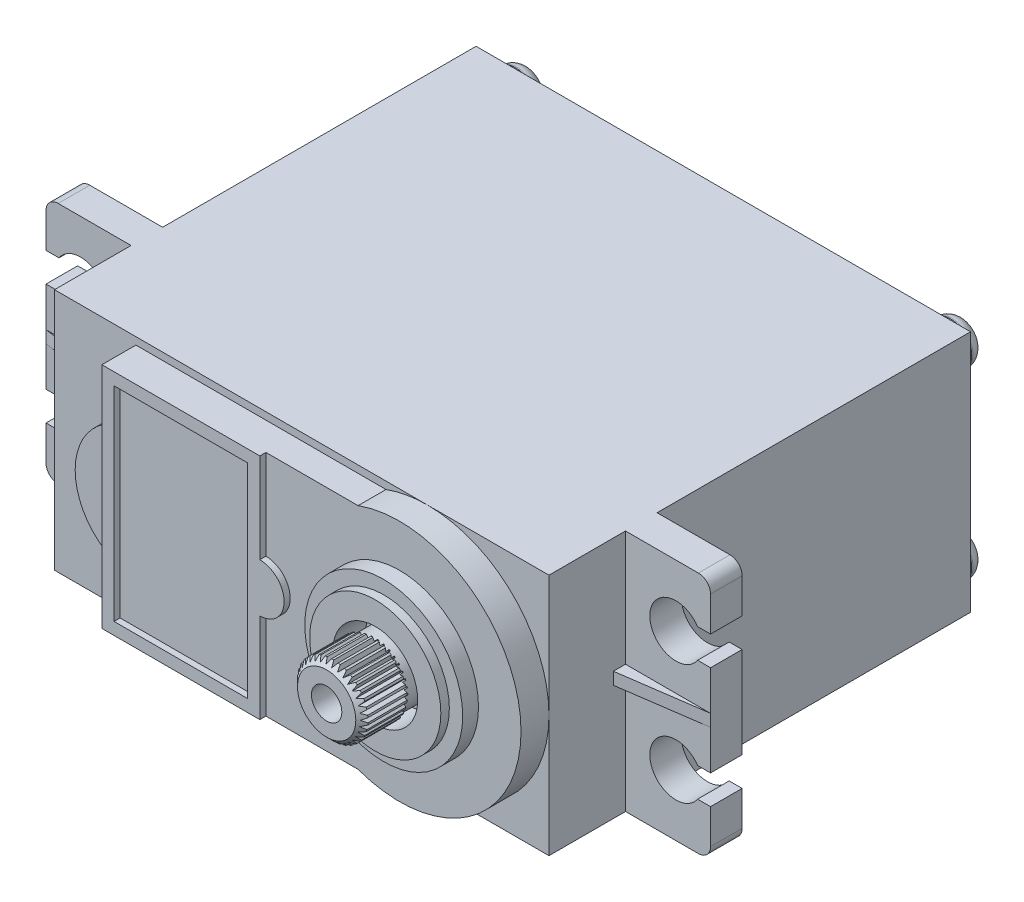
from build123d import *

# Parameters (mm, degrees)
SKETCH1_W                         = 40.7
SKETCH1_H                         = 36.7
BOSS_EXTRUDE1_DEPTH               = 20
CHAMFER1_SIZE                     = 2
CUT_EXTRUDE1_DEPTH                = 1.2
SKETCH3_R                         = 1.75
BOSS_EXTRUDE2_DEPTH               = 1.1
FILLET1_R                         = 1
SKETCH4_W                         = 2.5
SKETCH4_H                         = 0.75
CUT_EXTRUDE_THIN1_DEPTH           = 0.5
CUT_EXTRUDE_THIN1_DRAFT           = -18
SKETCH4_W_2                       = 0.75
SKETCH4_H_2                       = 2.5
CUT_EXTRUDE_THIN1_PROFILE_2_DEPTH = 0.5
CUT_EXTRUDE_THIN1_PROFILE_2_DRAFT = -18
SKETCH5_R                         = 10
BOSS_EXTRUDE3_DEPTH               = 2.3
SKETCH6_R                         = 5.34
BOSS_EXTRUDE4_DEPTH               = 2
SKETCH7_R                         = 6.5
BOSS_EXTRUDE5_DEPTH               = 1.3
SKETCH8_R                         = 5.4
BOSS_EXTRUDE6_DEPTH               = 2
SKETCH9_R                         = 3
CUT_EXTRUDE2_DEPTH                = 2
SKETCH10_R                        = 2.9
BOSS_EXTRUDE7_DEPTH               = 6
CHAMFER2_SIZE                     = 0.5
SKETCH11_R                        = 1.25
CUT_EXTRUDE3_DEPTH                = 3
CUT_EXTRUDE4_START                = -3.716155895
SKETCH12_R                        = 3.49567467
SKETCH12_R_2                      = 2.678747668
CUT_EXTRUDE4_DEPTH                = 3
CUT_EXTRUDE5_DEPTH                = 4
CIRPATTERN1_COUNT                 = 34
BOSS_EXTRUDE8_DEPTH               = 0.5
SKETCH15_W                        = 11
SKETCH15_H                        = 16.8
CUT_EXTRUDE6_DEPTH                = 0.5
BOSS_EXTRUDE9_DEPTH               = 2.6
CUT_EXTRUDE7_START                = -4.6
CUT_EXTRUDE7_DEPTH                = 19.6
RIB1_REACH                        = 41.475
SKETCH18_WALL_W                   = 88.020292
SKETCH18_WALL_H                   = 1


# Read off the part's stored shape, not the designer's step: Mirror2, Mirror3
with BuildPart() as part:
    # Sketch1 → Boss-Extrude1 (new body)
    with BuildSketch(Plane(origin=(0, 0, 0), x_dir=(1, 0, 0), z_dir=(0, 1, 0))):
        Rectangle(SKETCH1_W, SKETCH1_H)
    extrude(amount=BOSS_EXTRUDE1_DEPTH)

    # Chamfer1
    chamfer1_edges = [part.edges().sort_by_distance(p)[0] for p in [
        (0, 0, -18.35),
        (0, 20, -18.35),
        (-20.35, 10, -18.35),
        (20.35, 10, -18.35),
    ]]
    chamfer(chamfer1_edges, length=CHAMFER1_SIZE)

    # Sketch2 → Cut-Extrude1 (cut)
    with BuildSketch(Plane(origin=(0, 0, -18.35), x_dir=(-1, 0, 0), z_dir=(0, 0, -1))):
        with BuildLine():
            Line((20.35, 20), (15.85, 20))
            Line((15.85, 20), (15.85, 18))
            ThreePointArc((15.85, 18), (16.582233047, 16.232233047), (18.35, 15.5))
            Line((18.35, 15.5), (20.35, 15.5))
            Line((20.35, 15.5), (20.35, 20))
        make_face()
    extrude(amount=-CUT_EXTRUDE1_DEPTH, mode=Mode.SUBTRACT)

    # Sketch3 → Boss-Extrude2 (add)
    with BuildSketch(Plane(origin=(0, 0, -17.15), x_dir=(-1, 0, 0), z_dir=(0, 0, -1))):
        with Locations(Location((17.9, 17.55, 0), (0, 0, 109.462950946))):
            Circle(SKETCH3_R)
    extrude(amount=BOSS_EXTRUDE2_DEPTH)

    # Fillet1
    fillet1_edges = [part.edges().sort_by_distance(p)[0] for p in [
        (-18.483095189, 15.9, -18.25),
    ]]
    fillet(fillet1_edges, radius=FILLET1_R)


with BuildPart() as cut_extrude_thin1_tool:
    # Sketch4 → Cut-Extrude-Thin1 (with draft: the straight prism first)
    with BuildSketch(Plane(origin=(0, 0, -18.25), x_dir=(-1, 0, 0), z_dir=(0, 0, -1))):
        with Locations((17.9, 17.55)):
            Rectangle(SKETCH4_W, SKETCH4_H)
    extrude(amount=-CUT_EXTRUDE_THIN1_DEPTH)
    # Cut-Extrude-Thin1: the draft: its side faces are tilted about the plane it starts from
    cut_extrude_thin1_sides = [cut_extrude_thin1_tool.faces().sort_by_distance(p)[0] for p in [
        (-17.9, 17.175, -18),
        (-19.15, 17.55, -18),
        (-17.9, 17.925, -18),
        (-16.65, 17.55, -18),
    ]]
    draft(cut_extrude_thin1_sides, Plane(origin=(0, 0, -18.25), x_dir=(-1, 0, 0), z_dir=(0, 0, -1)), CUT_EXTRUDE_THIN1_DRAFT)


with BuildPart() as part_1:
    add(part.part)

    # Cut-Extrude-Thin1: cut by cut_extrude_thin1_tool
    add(cut_extrude_thin1_tool.part, mode=Mode.SUBTRACT)


with BuildPart() as cut_extrude_thin1_profile_2_tool:
    # Sketch4 → Cut-Extrude-Thin1 profile 2 (with draft: the straight prism first)
    with BuildSketch(Plane(origin=(0, 0, -18.25), x_dir=(-1, 0, 0), z_dir=(0, 0, -1))):
        with Locations((17.9, 17.55)):
            Rectangle(SKETCH4_W_2, SKETCH4_H_2)
    extrude(amount=-CUT_EXTRUDE_THIN1_PROFILE_2_DEPTH)
    # Cut-Extrude-Thin1 profile 2: the draft: its side faces are tilted about the plane it starts from
    cut_extrude_thin1_profile_2_sides = [cut_extrude_thin1_profile_2_tool.faces().sort_by_distance(p)[0] for p in [
        (-18.275, 17.55, -18),
        (-17.9, 18.8, -18),
        (-17.525, 17.55, -18),
        (-17.9, 16.3, -18),
    ]]
    draft(cut_extrude_thin1_profile_2_sides, Plane(origin=(0, 0, -18.25), x_dir=(-1, 0, 0), z_dir=(0, 0, -1)), CUT_EXTRUDE_THIN1_PROFILE_2_DRAFT)


with BuildPart() as part_2:
    add(part_1.part)

    # Cut-Extrude-Thin1 profile 2: cut by cut_extrude_thin1_profile_2_tool
    add(cut_extrude_thin1_profile_2_tool.part, mode=Mode.SUBTRACT)

    # Mirror2
    split(bisect_by=Plane(origin=(0, 10, 0), x_dir=(0, 0, 1), z_dir=(0, -1, 0)), keep=Keep.BOTTOM)

    # Mirror2 2: part across plane


with BuildPart() as part_3:
    add(part_2.part)
    add(part_2.part.mirror(Plane(origin=(0, 10, 0), x_dir=(0, 0, 1), z_dir=(0, -1, 0))))

    # Mirror3
    split(bisect_by=Plane.ZY, keep=Keep.TOP)

    # Mirror3 2: part across plane


with BuildPart() as part_4:
    add(part_3.part)
    add(part_3.part.mirror(Plane.ZY))

    # Sketch5 → Boss-Extrude3 (add)
    with BuildSketch(Plane.XY.offset(18.35)):
        with Locations((10.35, 10)):
            Circle(SKETCH5_R)
        with BuildLine():
            Line((6.938255578, 19.4), (-13.65, 19.4))
            Line((-13.65, 19.4), (-13.65, 0.6))
            Line((-13.65, 0.6), (6.938255578, 0.6))
            ThreePointArc((6.938255578, 0.6), (0.35, 10), (6.938255578, 19.4))
        make_face()
    extrude(amount=BOSS_EXTRUDE3_DEPTH)

    # Sketch6 → Boss-Extrude4 (add)
    with BuildSketch(Plane.XY.offset(18.35)):
        with Locations((-11.31, 10)):
            Circle(SKETCH6_R)
    extrude(amount=BOSS_EXTRUDE4_DEPTH)

    # Sketch7 → Boss-Extrude5 (add)
    with BuildSketch(Plane.XY.offset(20.65)):
        with Locations((10.35, 10)):
            Circle(SKETCH7_R)
    extrude(amount=BOSS_EXTRUDE5_DEPTH)

    # Sketch8 → Boss-Extrude6 (add)
    with BuildSketch(Plane.XY.offset(20.65)):
        with Locations((10.35, 10)):
            Circle(SKETCH8_R)
    extrude(amount=BOSS_EXTRUDE6_DEPTH)

    # Sketch9 → Cut-Extrude2 (cut)
    with BuildSketch(Plane.XY.offset(22.65)):
        with Locations((10.35, 10)):
            Circle(SKETCH9_R)
    extrude(amount=-CUT_EXTRUDE2_DEPTH, mode=Mode.SUBTRACT)

    # Sketch10 → Boss-Extrude7 (add)
    with BuildSketch(Plane.XY.offset(20.65)):
        with Locations((10.35, 10)):
            Circle(SKETCH10_R)
    extrude(amount=BOSS_EXTRUDE7_DEPTH)

    # Chamfer2
    chamfer2_edges = [part_4.edges().sort_by_distance(p)[0] for p in [
        (7.45, 10, 26.65),
    ]]
    chamfer(chamfer2_edges, length=CHAMFER2_SIZE)

    # Sketch11 → Cut-Extrude3 (cut)
    with BuildSketch(Plane.XY.offset(26.65)):
        with Locations((10.35, 10)):
            Circle(SKETCH11_R)
    extrude(amount=-CUT_EXTRUDE3_DEPTH, mode=Mode.SUBTRACT)

    # Sketch12 → Cut-Extrude4 (cut)
    with BuildSketch(Plane.XY.offset(26.65).offset(CUT_EXTRUDE4_START)):
        with Locations((10.35, 10)):
            Circle(SKETCH12_R)
        with Locations((10.35, 10)):
            Circle(SKETCH12_R_2, mode=Mode.SUBTRACT)
    extrude(amount=-CUT_EXTRUDE4_DEPTH, mode=Mode.SUBTRACT)

    # Sketch13 → Cut-Extrude5 (cut)
    with BuildSketch(Plane.XY.offset(26.65)):
        Polygon((12.927796823, 10), (13.290446978, 9.790623835), (13.290446978, 10.209376165), align=None)
    cut_extrude5 = extrude(amount=-CUT_EXTRUDE5_DEPTH, mode=Mode.SUBTRACT)

    # CirPattern1: Cut-Extrude5 ×34 about axis
    cirpattern1_axis = Axis((10.35, 10, 0), (0, 0, 1))
    for i in range(1, CIRPATTERN1_COUNT):
        add(cut_extrude5.rotate(cirpattern1_axis, i * 360 / CIRPATTERN1_COUNT), mode=Mode.SUBTRACT)

    # Sketch14 → Boss-Extrude8 (add)
    with BuildSketch(Plane.XY.offset(20.65)):
        with BuildLine():
            Line((-13.65, 0.6), (-0.65, 0.6))
            Line((-0.65, 0.6), (-0.65, 8))
            ThreePointArc((-0.65, 8), (1.35, 10), (-0.65, 12))
            Line((-0.65, 12), (-0.65, 19.4))
            Line((-0.65, 19.4), (-13.65, 19.4))
            Line((-13.65, 19.4), (-13.65, 0.6))
        make_face()
    extrude(amount=BOSS_EXTRUDE8_DEPTH)

    # Sketch15 → Cut-Extrude6 (cut)
    with BuildSketch(Plane.XY.offset(21.15)):
        with Locations((-7.15, 10)):
            Rectangle(SKETCH15_W, SKETCH15_H)
    extrude(amount=-CUT_EXTRUDE6_DEPTH, mode=Mode.SUBTRACT)

    # Sketch16 → Boss-Extrude9 (add)
    with BuildSketch(Plane.XY.offset(12.05)):
        with BuildLine():
            Line((-20.35, 20), (-26.35, 20))
            ThreePointArc((-26.35, 20), (-27.057106781, 19.707106781), (-27.35, 19))
            Line((-27.35, 19), (-27.35, 1))
            ThreePointArc((-27.35, 1), (-27.057106781, 0.292893219), (-26.35, 0))
            Line((-26.35, 0), (-20.35, 0))
            Line((-20.35, 0), (-20.35, 20))
        make_face()
    boss_extrude9 = extrude(amount=-BOSS_EXTRUDE9_DEPTH)

    # Sketch17 → Cut-Extrude7 (cut)
    with BuildSketch(Plane.XY.offset(12.05).offset(CUT_EXTRUDE7_START)):
        with BuildLine():
            Line((-26.283956277, 16.15), (-28.177190853, 16.15))
            Line((-28.177190853, 16.15), (-28.177190853, 13.75))
            Line((-28.177190853, 13.75), (-26.283956277, 13.75))
            ThreePointArc((-26.283956277, 13.75), (-22.35, 14.95), (-26.283956277, 16.15))
        make_face()
        with BuildLine():
            Line((-28.177190853, 6.25), (-26.283956277, 6.25))
            ThreePointArc((-26.283956277, 6.25), (-22.35, 5.05), (-26.283956277, 3.85))
            Line((-26.283956277, 3.85), (-28.177190853, 3.85))
            Line((-28.177190853, 3.85), (-28.177190853, 6.25))
        make_face()
    cut_extrude7 = extrude(amount=CUT_EXTRUDE7_DEPTH, mode=Mode.SUBTRACT)

    # Sketch18 wall → Rib1 (add, up to next)
    with BuildSketch(Plane(origin=(-23.85, 10, 12.55), x_dir=(0.989949493661, 0, 0.141421356237), z_dir=(-0.141421356237, 0, 0.989949493661)), mode=Mode.PRIVATE) as rib1_sk1:
        Rectangle(SKETCH18_WALL_W, SKETCH18_WALL_H)
    rib1_tool1 = extrude(rib1_sk1.sketch, amount=-RIB1_REACH, mode=Mode.PRIVATE) - part_4.part
    rib1 = rib1_tool1.solids().sort_by_distance((-23.85, 10, 12.55))[0]
    add(rib1)

    # Mirror4: Boss-Extrude9, Cut-Extrude7, Rib1 across plane
    add(boss_extrude9.mirror(Plane.ZY))
    add(cut_extrude7.mirror(Plane.ZY), mode=Mode.SUBTRACT)
    add(rib1.mirror(Plane.ZY))


solid = part_4.part
